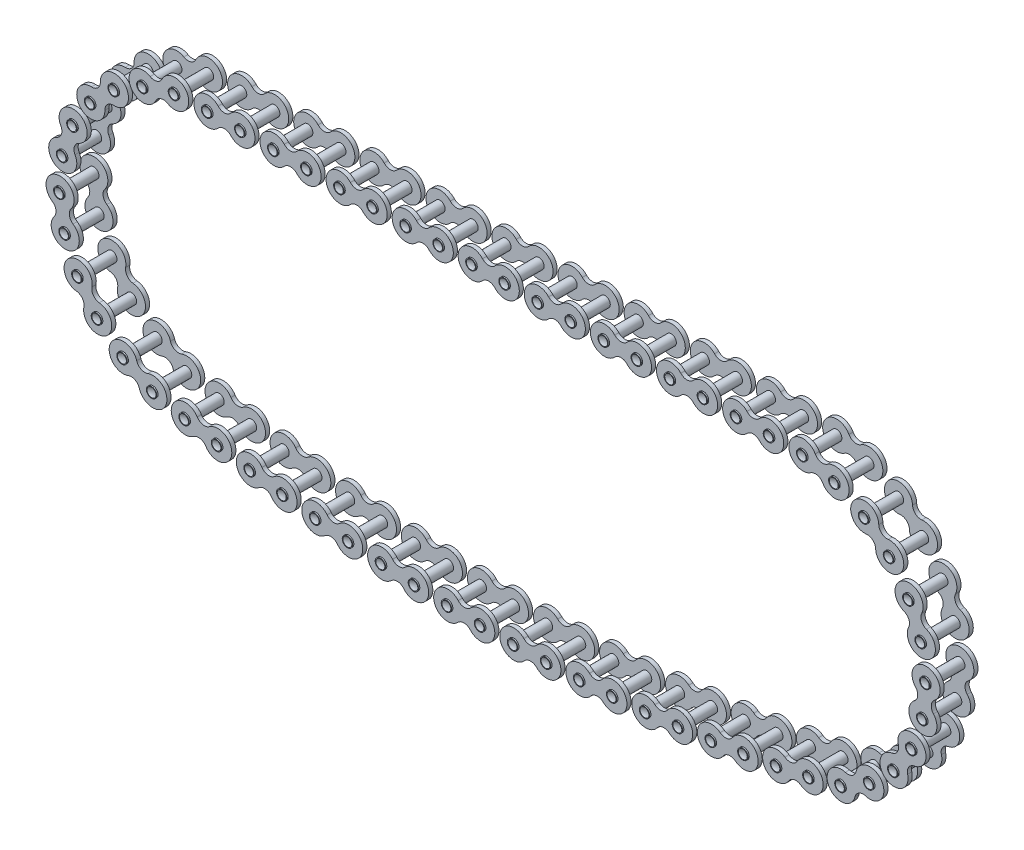
from build123d import *

# Parameters (mm, degrees)
SKETCH1_R            = 1.9812
BOSS_EXTRUDE1_DEPTH  = 1.5875
BOSS_EXTRUDE2_START  = -15.065248
SKETCH4_R            = 1.9812
BOSS_EXTRUDE2_DEPTH  = 15.573248
CRVPATTERN1_6_ANGLE  = 13.5801439
CRVPATTERN1_7_ANGLE  = 40.8898577
CRVPATTERN1_8_ANGLE  = 68.1995715
CRVPATTERN1_9_ANGLE  = 95.5092853
CRVPATTERN1_10_ANGLE = 122.8189991
CRVPATTERN1_11_ANGLE = 150.1287129
CRVPATTERN1_12_ANGLE = 168.7549205
CRVPATTERN1_13_ANGLE = 171.21869
CRVPATTERN1_14_ANGLE = 173.6824594
CRVPATTERN1_15_ANGLE = 176.1462288
CRVPATTERN1_16_ANGLE = 178.6099982
CRVPATTERN1_17_ANGLE = 178.9262323
CRVPATTERN1_18_ANGLE = 176.4624629
CRVPATTERN1_19_ANGLE = 173.9986935
CRVPATTERN1_20_ANGLE = 171.5349241
CRVPATTERN1_21_ANGLE = 169.0711546
CRVPATTERN1_22_ANGLE = 153.6340174
CRVPATTERN1_23_ANGLE = 126.3243036
CRVPATTERN1_24_ANGLE = 99.0145899
CRVPATTERN1_25_ANGLE = 71.7048761
CRVPATTERN1_26_ANGLE = 44.3951623
CRVPATTERN1_27_ANGLE = 17.0854485


with BuildPart() as part:
    # Sketch1 → Boss-Extrude1 (new body)
    with BuildSketch(Plane.XY):
        with BuildLine():
            ThreePointArc((2.389431316, -3.667001765), (11.7475, 0), (2.389431316, 3.667001765))
            ThreePointArc((2.389431316, 3.667001765), (0, 2.622983342), (-2.389431316, 3.667001765))
            ThreePointArc((-2.389431316, 3.667001765), (-11.7475, 0), (-2.389431316, -3.667001765))
            ThreePointArc((-2.389431316, -3.667001765), (0, -2.622983342), (2.389431316, -3.667001765))
        make_face()
        with Locations((6.35, 0)):
            Circle(SKETCH1_R, mode=Mode.SUBTRACT)
        with Locations(Location((-6.35, 0, 0), (0, 0, 180))):
            Circle(SKETCH1_R, mode=Mode.SUBTRACT)
    boss_extrude1 = extrude(amount=BOSS_EXTRUDE1_DEPTH)

    # Sketch4 → Boss-Extrude2 (add)
    with BuildSketch(Plane.XY.offset(1.5875).offset(BOSS_EXTRUDE2_START)):
        with Locations(Location((-6.35, 0, 0), (0, 0, 180))):
            Circle(SKETCH4_R)
    boss_extrude2 = extrude(amount=BOSS_EXTRUDE2_DEPTH)

    # Mirror1: Boss-Extrude1 across plane
    add(boss_extrude1.mirror(Plane.XY.offset(-5.691124)))

    # Sketch5 → Cut-Revolve1 (revolve, cut)
    with BuildSketch(Plane(origin=(0, 0, 0), x_dir=(1, 0, 0), z_dir=(0, 1, 0)), mode=Mode.PRIVATE) as cut_revolve1_sk:
        with BuildLine():
            Line((-6.35, -1.5875), (-6.35, -2.410032772))
            Line((-6.35, -2.410032772), (-8.48225771, -2.410032772))
            ThreePointArc((-8.48225771, -2.410032772), (-7.492703275, -1.800261957), (-6.35, -1.5875))
        make_face()
    cut_revolve1 = revolve(cut_revolve1_sk.sketch.rotate(Axis((-6.35, 0, 1.5875), (0, 0, 1)), 180), axis=Axis((-6.35, 0, 1.5875), (0, 0, 1)), mode=Mode.SUBTRACT)

    # Mirror4: Cut-Revolve1 across plane
    add(cut_revolve1.mirror(Plane.XY.offset(-5.691124)), mode=Mode.SUBTRACT)

    # Mirror5: Boss-Extrude2 across plane
    add(boss_extrude2.mirror(Plane(origin=(0, 0, 0), x_dir=(0, 0, 1), z_dir=(1, 0, 0))))

    # Mirror6: Cut-Revolve1 across plane
    add(cut_revolve1.mirror(Plane(origin=(0, 0, 0), x_dir=(0, 0, 1), z_dir=(1, 0, 0))), mode=Mode.SUBTRACT)

    # Mirror6 copy 1 sketch → Mirror6 copy 1 (revolve, cut)
    with BuildSketch(Plane(origin=(0, 0, -11.382248), x_dir=(-1, 0, 0), z_dir=(0, 1, 0))):
        with BuildLine():
            Line((-6.35, -1.5875), (-6.35, -2.410032772))
            Line((-6.35, -2.410032772), (-8.48225771, -2.410032772))
            ThreePointArc((-8.48225771, -2.410032772), (-7.492703275, -1.800261957), (-6.35, -1.5875))
        make_face()
    revolve(axis=Axis((6.35, 0, -12.969748), (0, 0, -1)), mode=Mode.SUBTRACT)


with BuildPart() as body_2:
    # CrvPattern1: read off the stored shape, not the designer's step
    # CrvPattern1: copy of part
    add(part.part.moved(Location((25.3305116, 0, 0))))


with BuildPart() as body_3:
    # CrvPattern1 2: copy of part
    add(part.part.moved(Location((50.7305116, 0, 0))))


with BuildPart() as body_4:
    # CrvPattern1 3: copy of part
    add(part.part.moved(Location((76.1305116, 0, 0))))


with BuildPart() as body_5:
    # CrvPattern1 4: copy of part
    add(part.part.moved(Location((101.5305116, 0, 0))))


with BuildPart() as body_6:
    # CrvPattern1 5: copy of part
    add(part.part.moved(Location((126.9305116, 0, 0))))


with BuildPart() as body_7:
    # CrvPattern1 6: copy of part
    add(part.part.moved(Location((148.3069123, 34.2921316, 0))).rotate(Axis((0, 0, 0), (0, 0, -1)), CRVPATTERN1_6_ANGLE))


with BuildPart() as body_8:
    # CrvPattern1 7: copy of part
    add(part.part.moved(Location((140.4924028, 104.4527964, 0))).rotate(Axis((0, 0, 0), (0, 0, -1)), CRVPATTERN1_7_ANGLE))


with BuildPart() as body_9:
    # CrvPattern1 8: copy of part
    add(part.part.moved(Location((101.3591756, 163.2080171, 0))).rotate(Axis((0, 0, 0), (0, 0, -1)), CRVPATTERN1_8_ANGLE))


with BuildPart() as body_10:
    # CrvPattern1 9: copy of part
    add(part.part.moved(Location((39.6308518, 197.4600168, 0))).rotate(Axis((0, 0, 0), (0, 0, -1)), CRVPATTERN1_9_ANGLE))


with BuildPart() as body_11:
    # CrvPattern1 10: copy of part
    add(part.part.moved(Location((-30.9320241, 199.5733028, 0))).rotate(Axis((0, 0, 0), (0, 0, -1)), CRVPATTERN1_10_ANGLE))


with BuildPart() as body_12:
    # CrvPattern1 11: copy of part
    add(part.part.moved(Location((-94.5994999, 169.076779, 0))).rotate(Axis((0, 0, 0), (0, 0, -1)), CRVPATTERN1_11_ANGLE))


with BuildPart() as body_13:
    # CrvPattern1 12: copy of part
    add(part.part.moved(Location((-118.5503433, 132.8583929, 0))).rotate(Axis((0, 0, 0), (0, 0, -1)), CRVPATTERN1_12_ANGLE))


with BuildPart() as body_14:
    # CrvPattern1 13: copy of part
    add(part.part.moved(Location((-98.7598514, 128.1854071, 0))).rotate(Axis((0, 0, 0), (0, 0, -1)), CRVPATTERN1_13_ANGLE))


with BuildPart() as body_15:
    # CrvPattern1 14: copy of part
    add(part.part.moved(Location((-78.786773, 124.3674875, 0))).rotate(Axis((0, 0, 0), (0, 0, -1)), CRVPATTERN1_14_ANGLE))


with BuildPart() as body_16:
    # CrvPattern1 15: copy of part
    add(part.part.moved(Location((-58.6680344, 121.4116926, 0))).rotate(Axis((0, 0, 0), (0, 0, -1)), CRVPATTERN1_15_ANGLE))


with BuildPart() as body_17:
    # CrvPattern1 16: copy of part
    add(part.part.moved(Location((-38.4408308, 119.323487, 0))).rotate(Axis((0, 0, 0), (0, 0, -1)), CRVPATTERN1_16_ANGLE))


with BuildPart() as body_18:
    # CrvPattern1 17: copy of part
    add(part.part.moved(Location((-18.1425581, 118.1067316, 0))).rotate(Axis((0, 0, 0), (0, 0, 1)), CRVPATTERN1_17_ANGLE))


with BuildPart() as body_19:
    # CrvPattern1 18: copy of part
    add(part.part.moved(Location((2.1892563, 117.7636756, 0))).rotate(Axis((0, 0, 0), (0, 0, 1)), CRVPATTERN1_18_ANGLE))


with BuildPart() as body_20:
    # CrvPattern1 19: copy of part
    add(part.part.moved(Location((22.5170233, 118.2949535, 0))).rotate(Axis((0, 0, 0), (0, 0, 1)), CRVPATTERN1_19_ANGLE))


with BuildPart() as body_21:
    # CrvPattern1 20: copy of part
    add(part.part.moved(Location((42.8031611, 119.6995829, 0))).rotate(Axis((0, 0, 0), (0, 0, 1)), CRVPATTERN1_20_ANGLE))


with BuildPart() as body_22:
    # CrvPattern1 21: copy of part
    add(part.part.moved(Location((63.0101647, 121.974967, 0))).rotate(Axis((0, 0, 0), (0, 0, 1)), CRVPATTERN1_21_ANGLE))


with BuildPart() as body_23:
    # CrvPattern1 22: copy of part
    add(part.part.moved(Location((53.1275334, 139.0988068, 0))).rotate(Axis((0, 0, 0), (0, 0, 1)), CRVPATTERN1_22_ANGLE))


with BuildPart() as body_24:
    # CrvPattern1 23: copy of part
    add(part.part.moved(Location((7.836445, 153.9093449, 0))).rotate(Axis((0, 0, 0), (0, 0, 1)), CRVPATTERN1_23_ANGLE))


with BuildPart() as body_25:
    # CrvPattern1 24: copy of part
    add(part.part.moved(Location((-39.2015522, 146.2895319, 0))).rotate(Axis((0, 0, 0), (0, 0, 1)), CRVPATTERN1_24_ANGLE))


with BuildPart() as body_26:
    # CrvPattern1 25: copy of part
    add(part.part.moved(Location((-77.5006971, 117.9379848, 0))).rotate(Axis((0, 0, 0), (0, 0, 1)), CRVPATTERN1_25_ANGLE))


with BuildPart() as body_27:
    # CrvPattern1 26: copy of part
    add(part.part.moved(Location((-98.5233032, 75.174861, 0))).rotate(Axis((0, 0, 0), (0, 0, 1)), CRVPATTERN1_26_ANGLE))


with BuildPart() as body_28:
    # CrvPattern1 27: copy of part
    add(part.part.moved(Location((-97.5829884, 27.532962, 0))).rotate(Axis((0, 0, 0), (0, 0, 1)), CRVPATTERN1_27_ANGLE))


with BuildPart() as body_29:
    # CrvPattern1 28: copy of part
    add(part.part.moved(Location((-76.2, 0, 0))))


with BuildPart() as body_30:
    # CrvPattern1 29: copy of part
    add(part.part.moved(Location((-50.8, 0, 0))))


with BuildPart() as body_31:
    # CrvPattern1 30: copy of part
    add(part.part.moved(Location((-25.4, 0, 0))))


solid = Compound([part.part, body_2.part, body_3.part, body_4.part, body_5.part, body_6.part, body_7.part, body_8.part, body_9.part, body_10.part, body_11.part, body_12.part, body_13.part, body_14.part, body_15.part, body_16.part, body_17.part, body_18.part, body_19.part, body_20.part, body_21.part, body_22.part, body_23.part, body_24.part, body_25.part, body_26.part, body_27.part, body_28.part, body_29.part, body_30.part, body_31.part])
